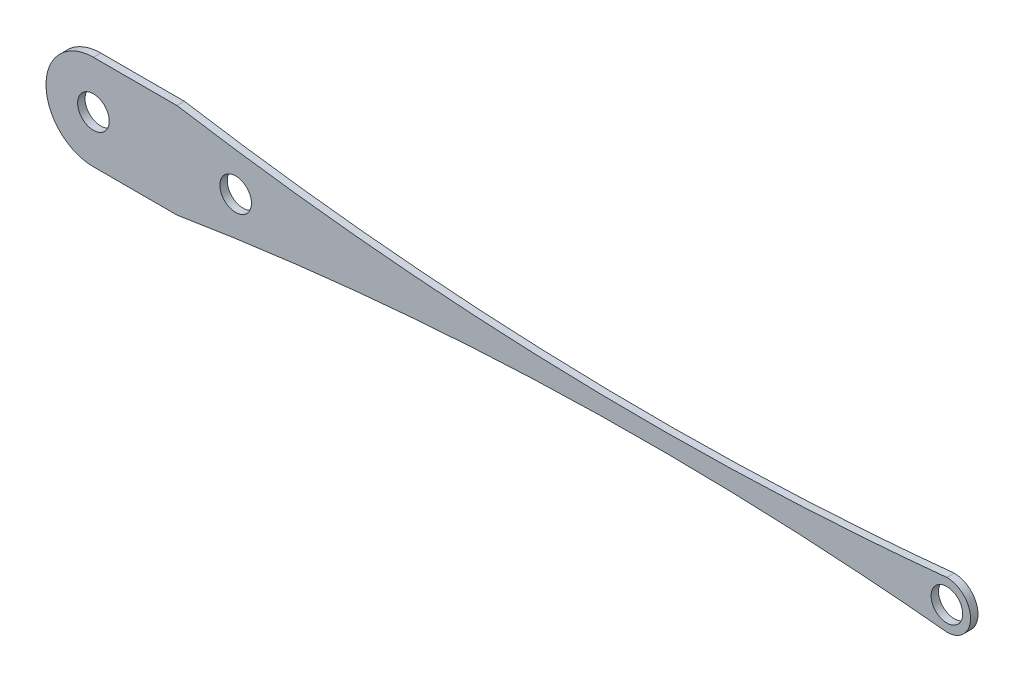
from build123d import *

# Parameters (mm, degrees)
SKETCH4_R           = 8.466666667
BOSS_EXTRUDE2_DEPTH = 3.96875
SCALE1_SCALE        = 0.75


with BuildPart() as part:
    # Sketch4 → Boss-Extrude2 (new body)
    with BuildSketch(Plane.XY):
        with BuildLine():
            Line((44.742290553, 25.4), (0, 25.4))
            ThreePointArc((0, 25.4), (-25.4, 0), (0, -25.4))
            Line((0, -25.4), (44.742290553, -25.4))
            add(Edge.make_bspline(
                [(44.742290553, -25.4), (48.709211627, -24.754322793), (52.676896009, -24.128863136)],
                knots=[0, 0, 0, 0.019331262, 0.019331262, 0.019331262], degree=2))
            add(Edge.make_bspline(
                [(52.676896009, -24.128863136), (253.95626011, 7.600505915), (457.2, -12.7)],
                knots=[0.019331262, 0.019331262, 0.019331262, 1, 1, 1], degree=2))
            ThreePointArc((457.2, -12.7), (469.9, 0), (457.2, 12.7))
            add(Edge.make_bspline(
                [(52.676896009, 24.128863136), (253.95626011, -7.600505915), (457.2, 12.7)],
                knots=[0.019331262, 0.019331262, 0.019331262, 1, 1, 1], degree=2))
            add(Edge.make_bspline(
                [(44.742290553, 25.4), (48.709211627, 24.754322793), (52.676896009, 24.128863136)],
                knots=[0, 0, 0, 0.019331262, 0.019331262, 0.019331262], degree=2))
        make_face()
        Circle(SKETCH4_R, mode=Mode.SUBTRACT)
        with Locations((76.2, 0)):
            Circle(SKETCH4_R, mode=Mode.SUBTRACT)
        with Locations((457.2, 0)):
            Circle(SKETCH4_R, mode=Mode.SUBTRACT)
    extrude(amount=BOSS_EXTRUDE2_DEPTH)


with BuildPart() as part_1:
    # Scale1: scaled about (157.512673369, 0, 1.984375)
    add(part.part.scale(SCALE1_SCALE).moved(Location((39.378168342, 0, 0.49609375))))


solid = part_1.part
